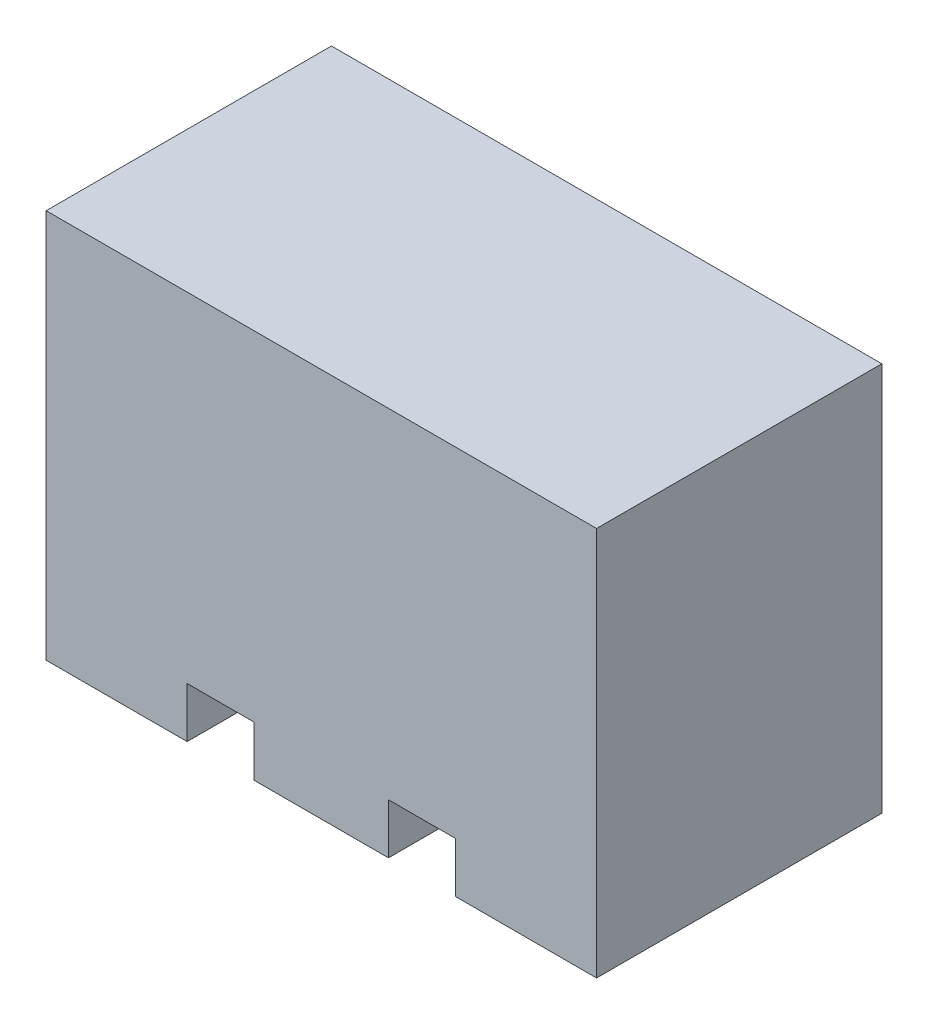
from build123d import *

# Parameters (mm, degrees)
SKICA1_W                 = 16.4
SKICA1_H                 = 11.6
P_IDAT_VYSUNUT_M1_DEPTH  = 8.5
SKICA2_W                 = 2
SKICA2_H                 = 1.5
ODEBRAT_VYSUNUT_M1_DEPTH = 22.812152576


with BuildPart() as part:
    # Skica1 → Přidat vysunutím1 (new body)
    with BuildSketch(Plane.XY):
        with Locations((8.2, 5.8)):
            Rectangle(SKICA1_W, SKICA1_H)
    extrude(amount=P_IDAT_VYSUNUT_M1_DEPTH)

    # Skica2 → Odebrat vysunutím1 (cut, through all)
    with BuildSketch(Plane.XY.offset(8.5)):
        with Locations((5.2, 0.75)):
            Rectangle(SKICA2_W, SKICA2_H)
        with Locations((11.2, 0.75)):
            Rectangle(SKICA2_W, SKICA2_H)
    extrude(amount=-ODEBRAT_VYSUNUT_M1_DEPTH, mode=Mode.SUBTRACT)


solid = part.part
